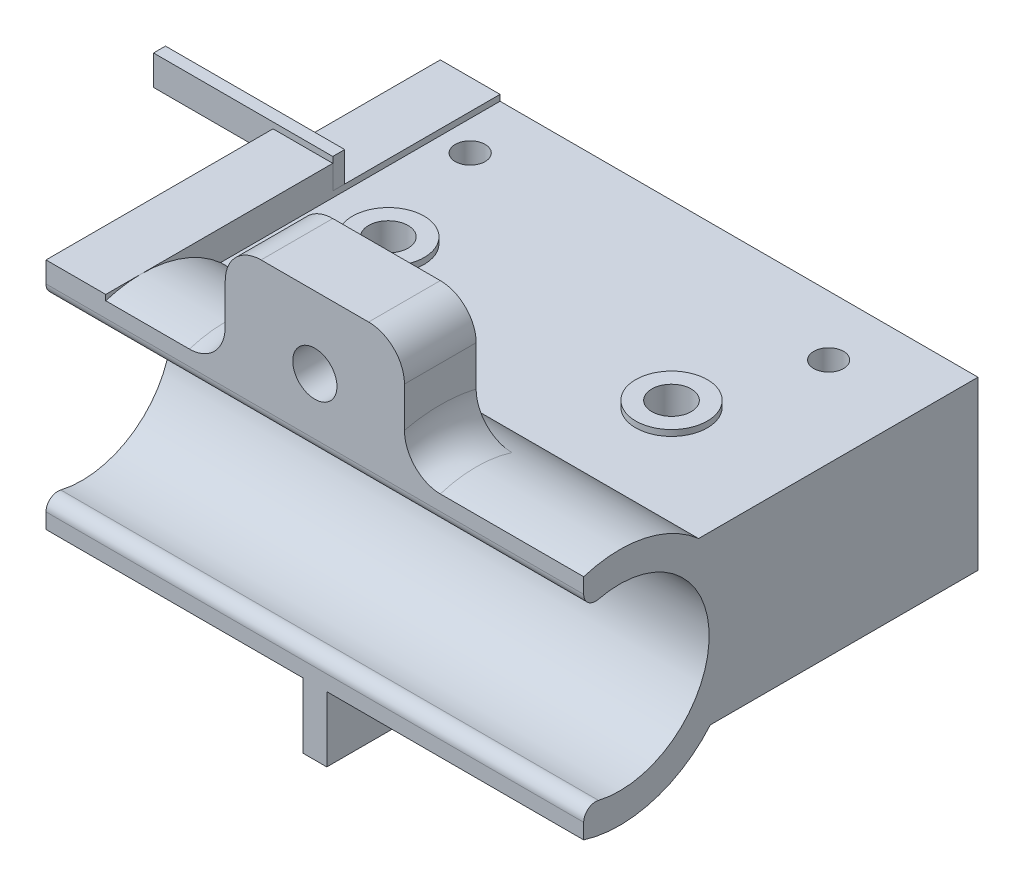
from build123d import *
from build123d.topology import SkipClean

# Parameters (mm, degrees)
SKETCH2_R                      = 10
SKETCH2_R_2                    = 7.5
BOSS_EXTRUDE1_DEPTH            = 22.5
BOSS_EXTRUDE2_REACH            = 58.575
BOSS_EXTRUDE2_END_RADIUS       = 10
BOSS_EXTRUDE2_START            = -30
BOSS_EXTRUDE4_REACH            = 59.81
BOSS_EXTRUDE4_END_RADIUS       = 10
BOSS_EXTRUDE4_START            = 19
SKETCH5_W                      = 15
SKETCH5_H                      = 6
BOSS_EXTRUDE5_REACH            = 52.039
BOSS_EXTRUDE5_START            = 8
SKETCH6_R                      = 3
BOSS_EXTRUDE6_REACH            = 59.039
BOSS_EXTRUDE6_START            = -15
SKETCH7_R                      = 3.25
BOSS_EXTRUDE7_REACH            = 46.491
BOSS_EXTRUDE7_START            = -0.5
SKETCH9_W                      = 2.5
SKETCH9_H                      = 10.75
BOSS_EXTRUDE8_REACH            = 54.119
BOSS_EXTRUDE8_START            = -1.5
SKETCH10_W                     = 17
SKETCH10_H                     = 2.5
CUT_EXTRUDE2_DEPTH             = 43.038672797
CUT_EXTRUDE2_DEPTH_BACK        = 43.038672797
SKETCH11_W                     = 10.458909091
SKETCH11_H                     = 30
FILLET1_R                      = 1
M3X0_5_TAPPED_HOLE1_D          = 2.75
M3X0_5_TAPPED_HOLE1_DEPTH      = 8.5
M3X0_5_TAPPED_HOLE1_TIP        = 0.826183351
SKETCH14_R                     = 4
CUT_EXTRUDE3_DEPTH             = 10
M4X0_7_TAPPED_HOLE2_D          = 3.7
M4X0_7_TAPPED_HOLE2_DEPTH      = 11.5
M4X0_7_TAPPED_HOLE2_TIP        = 1.111592145
BOSS_EXTRUDE9_REACH            = 45.732
DELETEFACE1_START              = -28.2500001
DELETEFACE1_DEPTH              = 6.5000001
BOSS_EXTRUDE10_REACH           = 46.23
SKETCH20_W                     = 2
SKETCH20_H                     = 13
DELETEFACE2_START              = -1
DELETEFACE2_DEPTH              = 2
BOSS_EXTRUDE12_REACH           = 46.23
BOSS_EXTRUDE12_END_RADIUS      = 10
M4X0_7_TAPPED_HOLE1_D          = 3.3
M4X0_7_TAPPED_HOLE1_DEPTH      = 20
M4X0_7_TAPPED_HOLE1_TIP        = 0.991420021
BOSS_EXTRUDE11_DEPTH           = 10
BOSS_EXTRUDE11_DEPTH_BACK      = 5
SKETCH22_W                     = 1
SKETCH22_H                     = 2.5
BOSS_EXTRUDE13_START           = -5
BOSS_EXTRUDE13_DEPTH           = 5
SKETCH28_W                     = 1.25
SKETCH28_H                     = 7.5
M3X0_5_TAPPED_HOLE2_AT_2_COUNT = 2
M3X0_5_TAPPED_HOLE2_AT_2_PITCH = 30
FILLET4_R                      = 3


# Read off the part's stored shape, not the designer's step: DeleteFace1, DeleteFace2
with BuildPart() as part:
    # Sketch2 → Boss-Extrude1 (new, symmetric)
    with BuildSketch(Plane(origin=(0, 0, 0), x_dir=(0, 0, -1), z_dir=(1, 0, 0))):
        with Locations(Location((0, 0, 0), (0, 0, 180))):
            Circle(SKETCH2_R)
        with Locations(Location((0, 0, 0), (0, 0, 180))):
            Circle(SKETCH2_R_2, mode=Mode.SUBTRACT)
    extrude(amount=BOSS_EXTRUDE1_DEPTH, both=True)

    # Boss-Extrude2: up to this cylinder (the profile starts outside it)
    boss_extrude2_end = Plane(origin=(0, 0, 0), z_dir=(-1, 0, 0)) * Cylinder(BOSS_EXTRUDE2_END_RADIUS, 138.15, mode=Mode.PRIVATE)
    # Sketch3 → Boss-Extrude2 (add, up to the surface)
    with BuildSketch(Plane.XY.offset(BOSS_EXTRUDE2_START), mode=Mode.PRIVATE) as boss_extrude2_sk1:
        with BuildLine():
            Line((-8.815341562, 2), (8.815341562, 2))
            ThreePointArc((8.815341562, 2), (21.5, 0), (8.815341562, -2))
            Line((8.815341562, -2), (-8.815341562, -2))
            ThreePointArc((-8.815341562, -2), (-21.5, 0), (-8.815341562, 2))
        make_face()
    boss_extrude2_tool1 = extrude(boss_extrude2_sk1.sketch, amount=BOSS_EXTRUDE2_REACH, mode=Mode.PRIVATE) - boss_extrude2_end
    add(boss_extrude2_tool1.solids().sort_by_distance((0, 0, -30))[0])

    # Boss-Extrude4: up to this cylinder (the profile starts outside it)
    boss_extrude4_end = Plane(origin=(0, 0, 0), z_dir=(-1, 0, 0)) * Cylinder(BOSS_EXTRUDE4_END_RADIUS, 140.62, mode=Mode.PRIVATE)
    # Sketch5 → Boss-Extrude4 (add, up to the surface)
    with BuildSketch(Plane(origin=(0, 0, 0), x_dir=(1, 0, 0), z_dir=(0, 1, 0)).offset(BOSS_EXTRUDE4_START), mode=Mode.PRIVATE) as boss_extrude4_sk1:
        Rectangle(SKETCH5_W, SKETCH5_H)
    boss_extrude4_tool1 = extrude(boss_extrude4_sk1.sketch, amount=-BOSS_EXTRUDE4_REACH, mode=Mode.PRIVATE) - boss_extrude4_end
    add(boss_extrude4_tool1.solids().sort_by_distance((0, 19, 0))[0])

    # Sketch6 → Boss-Extrude5 (add, up to next)
    with BuildSketch(Plane(origin=(0, 0, 0), x_dir=(1, 0, 0), z_dir=(0, 1, 0)).offset(BOSS_EXTRUDE5_START), mode=Mode.PRIVATE) as boss_extrude5_sk1:
        with Locations(Location((-11.85, 15, 0), (0, 0, 270))):
            Circle(SKETCH6_R)
    boss_extrude5_tool1 = extrude(boss_extrude5_sk1.sketch, amount=-BOSS_EXTRUDE5_REACH, mode=Mode.PRIVATE) - part.part
    # Sketch6 → Boss-Extrude5 (add, up to next)
    with BuildSketch(Plane(origin=(0, 0, 0), x_dir=(1, 0, 0), z_dir=(0, 1, 0)).offset(BOSS_EXTRUDE5_START), mode=Mode.PRIVATE) as boss_extrude5_sk2:
        with Locations(Location((11.85, 15, 0), (0, 0, 270))):
            Circle(SKETCH6_R)
    boss_extrude5_tool2 = extrude(boss_extrude5_sk2.sketch, amount=-BOSS_EXTRUDE5_REACH, mode=Mode.PRIVATE) - part.part
    add(boss_extrude5_tool1.solids().sort_by_distance((-11.85, 8, -15))[0])
    add(boss_extrude5_tool2.solids().sort_by_distance((11.85, 8, -15))[0])

    # Sketch7 → Boss-Extrude6 (add, up to next)
    with BuildSketch(Plane(origin=(0, 0, 0), x_dir=(1, 0, 0), z_dir=(0, 1, 0)).offset(BOSS_EXTRUDE6_START), mode=Mode.PRIVATE) as boss_extrude6_sk1:
        with Locations(Location((-11.5, 25, 0), (0, 0, 34.305037018))):
            Circle(SKETCH7_R)
    boss_extrude6_tool1 = extrude(boss_extrude6_sk1.sketch, amount=BOSS_EXTRUDE6_REACH, mode=Mode.PRIVATE) - part.part
    # Sketch7 → Boss-Extrude6 (add, up to next)
    with BuildSketch(Plane(origin=(0, 0, 0), x_dir=(1, 0, 0), z_dir=(0, 1, 0)).offset(BOSS_EXTRUDE6_START), mode=Mode.PRIVATE) as boss_extrude6_sk2:
        with Locations(Location((11.5, 25, 0), (0, 0, 145.694962982))):
            Circle(SKETCH7_R)
    boss_extrude6_tool2 = extrude(boss_extrude6_sk2.sketch, amount=BOSS_EXTRUDE6_REACH, mode=Mode.PRIVATE) - part.part
    add(boss_extrude6_tool1.solids().sort_by_distance((-11.5, -15, -25))[0])
    add(boss_extrude6_tool2.solids().sort_by_distance((11.5, -15, -25))[0])

    # Sketch9 → Boss-Extrude7 (add, up to next)
    with BuildSketch(Plane(origin=(0, 8, 0), x_dir=(1, 0, 0), z_dir=(0, 1, 0)).offset(BOSS_EXTRUDE7_START), mode=Mode.PRIVATE) as boss_extrude7_sk1:
        with Locations((0, 8.375)):
            Rectangle(SKETCH9_W, SKETCH9_H)
    boss_extrude7_tool1 = extrude(boss_extrude7_sk1.sketch, amount=-BOSS_EXTRUDE7_REACH, mode=Mode.PRIVATE) - part.part
    # Sketch9 → Boss-Extrude7 (add, up to next)
    with BuildSketch(Plane(origin=(0, 8, 0), x_dir=(1, 0, 0), z_dir=(0, 1, 0)).offset(BOSS_EXTRUDE7_START), mode=Mode.PRIVATE) as boss_extrude7_sk2:
        with BuildLine():
            Line((-9.122821971, 16.25), (-9.122821971, 13.75))
            Line((-9.122821971, 13.75), (-1.25, 13.75))
            Line((-1.25, 13.75), (1.25, 13.75))
            Line((1.25, 13.75), (9.122821971, 13.75))
            ThreePointArc((9.122821971, 13.75), (8.85, 15), (9.122821971, 16.25))
            Line((9.122821971, 16.25), (-9.122821971, 16.25))
        make_face()
    boss_extrude7_tool2 = extrude(boss_extrude7_sk2.sketch, amount=-BOSS_EXTRUDE7_REACH, mode=Mode.PRIVATE) - part.part
    add(boss_extrude7_tool1.solids().sort_by_distance((0, 7.5, -8.375))[0])
    add(boss_extrude7_tool2.solids().sort_by_distance((-0.091621, 7.5, -15))[0])

    # Sketch10 → Boss-Extrude8 (add, up to next)
    with BuildSketch(Plane.XZ.offset(15).offset(BOSS_EXTRUDE8_START), mode=Mode.PRIVATE) as boss_extrude8_sk1:
        with Locations((0, -25)):
            Rectangle(SKETCH10_W, SKETCH10_H)
    boss_extrude8_tool1 = extrude(boss_extrude8_sk1.sketch, amount=-BOSS_EXTRUDE8_REACH, mode=Mode.PRIVATE) - part.part
    add(boss_extrude8_tool1.solids().sort_by_distance((0, -13.5, -25))[0])

    # Sketch11 → Cut-Extrude2 (cut, two sides: drawn at the far end of the back side and taken through both)
    with BuildSketch(Plane(origin=(0, 0, 0), x_dir=(0, 0, -1), z_dir=(1, 0, 0)).offset(-CUT_EXTRUDE2_DEPTH_BACK)):
        with Locations((-8.229454546, 5)):
            Rectangle(SKETCH11_W, SKETCH11_H)
    extrude(amount=CUT_EXTRUDE2_DEPTH + CUT_EXTRUDE2_DEPTH_BACK, mode=Mode.SUBTRACT)

    # Fillet1
    fillet1_edges = [part.edges().sort_by_distance(p)[0] for p in [
        (0, -6.873863542, 3),
        (0, 6.873863542, 3),
    ]]
    fillet(fillet1_edges, radius=FILLET1_R)

    # M3x0.5 Tapped Hole1
    with Locations(Plane(origin=(0, -15, 0), x_dir=(-1, 0, 0), z_dir=(0, -1, 0))):
        with Locations((-11.5, 25), (11.5, 25)):
            Hole(M3X0_5_TAPPED_HOLE1_D / 2, depth=M3X0_5_TAPPED_HOLE1_DEPTH)
            with Locations((0, 0, -(M3X0_5_TAPPED_HOLE1_DEPTH + M3X0_5_TAPPED_HOLE1_TIP / 2))):  # 118° drill point
                Cone(0, M3X0_5_TAPPED_HOLE1_D / 2, M3X0_5_TAPPED_HOLE1_TIP, mode=Mode.SUBTRACT)

    # Sketch14 → Cut-Extrude3 (cut)
    with BuildSketch(Plane(origin=(0, 0, -30), x_dir=(-1, 0, 0), z_dir=(0, 0, -1))):
        with Locations((-15, 0)):
            Circle(SKETCH14_R)
        with Locations((15, 0)):
            Circle(SKETCH14_R)
    extrude(amount=-CUT_EXTRUDE3_DEPTH, mode=Mode.SUBTRACT)

    # M4x0.7 Tapped Hole2
    with Locations(Plane(origin=(0, 0, -3), x_dir=(-1, 0, 0), z_dir=(0, 0, -1))):
        with Locations((0, 13)):
            Hole(M4X0_7_TAPPED_HOLE2_D / 2, depth=M4X0_7_TAPPED_HOLE2_DEPTH)
            with Locations((0, 0, -(M4X0_7_TAPPED_HOLE2_DEPTH + M4X0_7_TAPPED_HOLE2_TIP / 2))):  # 118° drill point
                Cone(0, M4X0_7_TAPPED_HOLE2_D / 2, M4X0_7_TAPPED_HOLE2_TIP, mode=Mode.SUBTRACT)

    # Sketch19 → Boss-Extrude9 (add, up to next)
    with BuildSketch(Plane(origin=(0, 7.5, 0), x_dir=(1, 0, 0), z_dir=(0, 1, 0)), mode=Mode.PRIVATE) as boss_extrude9_sk1:
        with BuildLine():
            Line((1.25, 6.614378278), (14.85, 6.614378278))
            Line((14.85, 6.614378278), (14.85, 15))
            ThreePointArc((14.85, 15), (12.489713183, 12.068998969), (9.122821971, 13.75))
            Line((9.122821971, 13.75), (1.25, 13.75))
            Line((1.25, 13.75), (1.25, 6.614378278))
        make_face()
    boss_extrude9_tool1 = extrude(boss_extrude9_sk1.sketch, amount=-BOSS_EXTRUDE9_REACH, mode=Mode.PRIVATE) - part.part
    # Sketch19 → Boss-Extrude9 (add, up to next)
    with BuildSketch(Plane(origin=(0, 7.5, 0), x_dir=(1, 0, 0), z_dir=(0, 1, 0)), mode=Mode.PRIVATE) as boss_extrude9_sk2:
        with BuildLine():
            Line((-14.85, 6.614378278), (-1.25, 6.614378278))
            Line((-1.25, 6.614378278), (-1.25, 13.75))
            Line((-1.25, 13.75), (-9.122821971, 13.75))
            ThreePointArc((-9.122821971, 13.75), (-12.489713183, 12.068998969), (-14.85, 15))
            Line((-14.85, 15), (-14.85, 6.614378278))
        make_face()
    boss_extrude9_tool2 = extrude(boss_extrude9_sk2.sketch, amount=-BOSS_EXTRUDE9_REACH, mode=Mode.PRIVATE) - part.part
    add(boss_extrude9_tool1.solids().sort_by_distance((7.769594, 7.5, -9.9707))[0])
    add(boss_extrude9_tool2.solids().sort_by_distance((-7.769594, 7.5, -9.9707))[0])

    # DeleteFace1 outline → DeleteFace1 (cut)
    with SkipClean():  # the faces are left unmerged after this step: merging them gives an invalid solid
        with BuildSketch(Plane.XY.offset(DELETEFACE1_START)):
            with BuildLine():
                ThreePointArc((16, -6.422616289), (11.592646997, -5.535336079), (8.815341562, -2))
                Line((8.815341562, -2), (-8.815341562, -2))
                ThreePointArc((-8.815341562, -2), (-11.592646997, -5.535336079), (-16, -6.422616289))
                Line((-16, -6.422616289), (-16, -15))
                Line((-16, -15), (-3.317867395, -15))
                Line((-3.317867395, -15), (-3.802938645, -13.5))
                Line((-3.802938645, -13.5), (3.802938645, -13.5))
                Line((3.802938645, -13.5), (3.317867395, -15))
                Line((3.317867395, -15), (16, -15))
                Line((16, -15), (16, -6.422616289))
            make_face()
        extrude(amount=DELETEFACE1_DEPTH, mode=Mode.SUBTRACT)

    # Boss-Extrude10: up to this face of the body (flat: up to its plane)
    boss_extrude10_end = Plane(part.part.faces().sort_by_distance((0, -8.900373918, 3))[0])
    # Sketch20 → Boss-Extrude10 (add, up to the picked face)
    with BuildSketch(Plane(origin=(0, 0, -30), x_dir=(-1, 0, 0), z_dir=(0, 0, -1)), mode=Mode.PRIVATE) as boss_extrude10_sk1:
        with Locations((0, -8.5)):
            Rectangle(SKETCH20_W, SKETCH20_H)
    boss_extrude10_tool1 = split(extrude(boss_extrude10_sk1.sketch, amount=-BOSS_EXTRUDE10_REACH, mode=Mode.PRIVATE), bisect_by=boss_extrude10_end, keep=Keep.BOTH, mode=Mode.PRIVATE)
    add(boss_extrude10_tool1.solids().sort_by(Axis((0, -8.5, -30), (0, 0, 1)))[0])

    # DeleteFace2 outline → DeleteFace2 (cut)
    with SkipClean():  # the faces are left unmerged after this step: merging them gives an invalid solid
        with BuildSketch(Plane.YZ.offset(DELETEFACE2_START)):
            with BuildLine():
                ThreePointArc((-7.289431607, 1.764705882), (-6.464707716, -3.802309055), (-2, -7.228416147))
                Line((-2, -7.228416147), (-2, 3))
                Line((-2, 3), (-8.261355821, 3))
                ThreePointArc((-8.261355821, 3), (-7.475450573, 2.618346942), (-7.289431607, 1.764705882))
            make_face()
        extrude(amount=DELETEFACE2_DEPTH, mode=Mode.SUBTRACT)

    # Boss-Extrude12: up to this cylinder (the profile starts outside it)
    boss_extrude12_end = Plane(origin=(0, 0, 0), z_dir=(-1, 0, 0)) * Cylinder(BOSS_EXTRUDE12_END_RADIUS, 125.136314, mode=Mode.PRIVATE)
    # Sketch23 → Boss-Extrude12 (add, up to the surface)
    with BuildSketch(Plane(origin=(0, 0, -30), x_dir=(-1, 0, 0), z_dir=(0, 0, -1)), mode=Mode.PRIVATE) as boss_extrude12_sk1:
        with BuildLine():
            Line((22.5, 7.5), (-22.5, 7.5))
            Line((-22.5, 7.5), (-22.5, -6.5))
            Line((-22.5, -6.5), (-14.999999993, -6.5))
            ThreePointArc((-14.999999993, -6.5), (-20.255949012, 3.824264632), (-8.815341562, 2))
            Line((-8.815341562, 2), (8.815341562, 2))
            ThreePointArc((8.815341562, 2), (20.25594901, 3.824264635), (15, -6.5))
            Line((15, -6.5), (22.5, -6.5))
            Line((22.5, -6.5), (22.5, 7.5))
        make_face()
    boss_extrude12_tool1 = extrude(boss_extrude12_sk1.sketch, amount=-BOSS_EXTRUDE12_REACH, mode=Mode.PRIVATE) - boss_extrude12_end
    add(boss_extrude12_tool1.solids().sort_by_distance((0, 3.628261, -30))[0])
    # Sketch23 → Boss-Extrude12 (add, up to the surface)
    with BuildSketch(Plane(origin=(0, 0, -30), x_dir=(-1, 0, 0), z_dir=(0, 0, -1)), mode=Mode.PRIVATE) as boss_extrude12_sk2:
        with BuildLine():
            ThreePointArc((-8.815341562, -2), (-11.175735362, -5.255949008), (-14.999999993, -6.5))
            Line((-14.999999993, -6.5), (-1, -6.5))
            Line((-1, -6.5), (-1, -2))
            Line((-1, -2), (-8.815341562, -2))
        make_face()
    boss_extrude12_tool2 = extrude(boss_extrude12_sk2.sketch, amount=-BOSS_EXTRUDE12_REACH, mode=Mode.PRIVATE) - boss_extrude12_end
    add(boss_extrude12_tool2.solids().sort_by_distance((5.838157, -4.433255, -30))[0])
    # Sketch23 → Boss-Extrude12 (add, up to the surface)
    with BuildSketch(Plane(origin=(0, 0, -30), x_dir=(-1, 0, 0), z_dir=(0, 0, -1)), mode=Mode.PRIVATE) as boss_extrude12_sk3:
        with BuildLine():
            Line((1, -6.5), (15, -6.5))
            ThreePointArc((15, -6.5), (11.175735365, -5.25594901), (8.815341562, -2))
            Line((8.815341562, -2), (1, -2))
            Line((1, -2), (1, -6.5))
        make_face()
    boss_extrude12_tool3 = extrude(boss_extrude12_sk3.sketch, amount=-BOSS_EXTRUDE12_REACH, mode=Mode.PRIVATE) - boss_extrude12_end
    add(boss_extrude12_tool3.solids().sort_by_distance((-5.838157, -4.433255, -30))[0])

    # M4x0.7 Tapped Hole1
    with Locations(Plane(origin=(0, 8, 0), x_dir=(1, 0, 0), z_dir=(0, 1, 0))):
        with Locations((11.85, 15), (-11.85, 15)):
            Hole(M4X0_7_TAPPED_HOLE1_D / 2, depth=M4X0_7_TAPPED_HOLE1_DEPTH)
            with Locations((0, 0, -(M4X0_7_TAPPED_HOLE1_DEPTH + M4X0_7_TAPPED_HOLE1_TIP / 2))):  # 118° drill point
                Cone(0, M4X0_7_TAPPED_HOLE1_D / 2, M4X0_7_TAPPED_HOLE1_TIP, mode=Mode.SUBTRACT)

    # Sketch24 → Boss-Extrude13 (add)
    with BuildSketch(Plane.ZY.offset(22.5).offset(BOSS_EXTRUDE13_START)):
        with BuildLine():
            ThreePointArc((-6.614378278, 7.5), (-3.535533906, 9.354143467), (0, 10))
            Line((0, 10), (-16, 10))
            Line((-16, 10), (-16, 8))
            Line((-16, 8), (-30, 8))
            Line((-30, 8), (-30, 7.5))
            Line((-30, 7.5), (-6.614378278, 7.5))
        make_face()
        with BuildLine():
            ThreePointArc((0, 10), (1.517576993, 9.884177258), (3, 9.539392014))
            Line((3, 9.539392014), (3, 10))
            Line((3, 10), (0, 10))
        make_face()
    extrude(amount=BOSS_EXTRUDE13_DEPTH)

    # Sketch28 → M3x0.5 Tapped Hole2 (revolve, cut)
    with BuildSketch(Plane(origin=(-15, 7.5, -25), x_dir=(0, 0, 1), z_dir=(1, 0, 0))):
        with Locations((0.625, 3.75)):
            Rectangle(SKETCH28_W, SKETCH28_H)
    m3x0_5_tapped_hole2 = revolve(axis=Axis((-15, 13.85, -25), (0, -1, 0)), mode=Mode.SUBTRACT)

    # M3x0.5 Tapped Hole2 at 2: M3x0.5 Tapped Hole2 ×2
    with Locations(*[(i * M3X0_5_TAPPED_HOLE2_AT_2_PITCH, 0, 0) for i in range(1, M3X0_5_TAPPED_HOLE2_AT_2_COUNT)]):
        add(m3x0_5_tapped_hole2, mode=Mode.SUBTRACT)

    # Fillet4
    fillet4_edges = [part.edges().sort_by_distance(p)[0] for p in [
        (7.5, 10, 0),
        (-7.5, 10, 0),
        (7.5, 19, 0),
        (-7.5, 19, 0),
    ]]
    fillet(fillet4_edges, radius=FILLET4_R)


with BuildPart() as body_2:
    # Sketch22 → Boss-Extrude11 (new, two sides: drawn at the far end of the back side and taken through both)
    with BuildSketch(Plane.ZY.offset(22.5).offset(-BOSS_EXTRUDE11_DEPTH_BACK)):
        with Locations((-16.5, 9.25)):
            Rectangle(SKETCH22_W, SKETCH22_H)
    extrude(amount=BOSS_EXTRUDE11_DEPTH + BOSS_EXTRUDE11_DEPTH_BACK)


solid = Compound([part.part, body_2.part])
